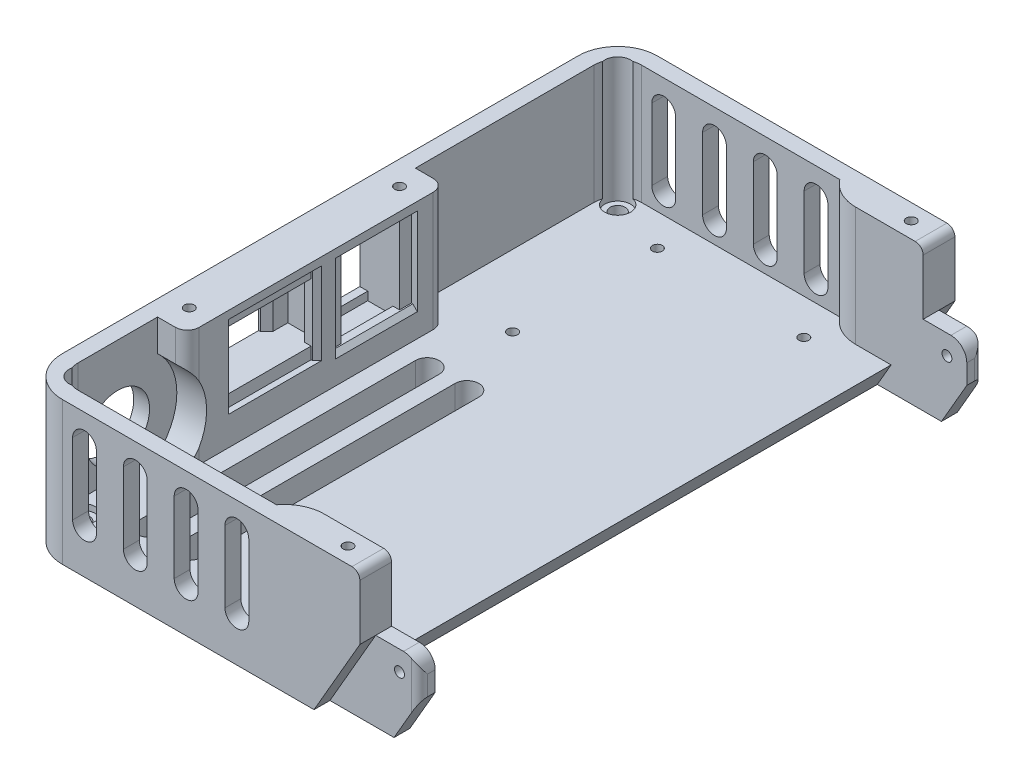
from build123d import *

# Parameters (mm, degrees)
BOSS_EXTRUDE1_DEPTH      = 150
FILLET1_R                = 10
CUT_EXTRUDE1_DEPTH       = 14
SKETCH3_W                = 36
SKETCH3_H                = 4
BOSS_EXTRUDE2_DEPTH      = 20
FILLET2_R                = 10
CUT_EXTRUDE2_DEPTH       = 176.874955579
FILLET3_R                = 4
SKETCH5_R                = 1.25
CUT_EXTRUDE3_DEPTH       = 176.874955579
FILLET4_R                = 2
SKETCH6_W                = 11.5
SKETCH6_H                = 65
BOSS_EXTRUDE3_DEPTH      = 30
CUT_EXTRUDE7_DEPTH       = 14.7
CUT_EXTRUDE8_DEPTH       = 17.7
CUT_EXTRUDE8_DEPTH_BACK  = 3
CUT_EXTRUDE9_DEPTH       = 14.7
CUT_EXTRUDE10_DEPTH      = 17.7
CUT_EXTRUDE10_DEPTH_BACK = 3
SKETCH25_W               = 6.35
SKETCH25_H               = 14.7
CUT_EXTRUDE19_DEPTH      = 1.5
CUT_EXTRUDE20_DEPTH      = 1.5
CHAMFER1_SIZE            = 1
SKETCH16_R               = 1.25
CUT_EXTRUDE11_DEPTH      = 181.599003373
BOSS_EXTRUDE4_DEPTH      = 16
FILLET5_R                = 3
CUT_EXTRUDE12_DEPTH      = 181.599003373
SKETCH19_R               = 1.9
CUT_EXTRUDE13_DEPTH      = 182.69204721
SKETCH20_R               = 3.25
CUT_EXTRUDE14_DEPTH      = 31.5
CUT_EXTRUDE15_DEPTH      = 179.404035883
CUT_EXTRUDE15_DEPTH_BACK = 179.404035883
SKETCH22_R               = 1.25
CUT_EXTRUDE16_DEPTH      = 8
FILLET6_R                = 2
SKETCH23_R               = 8
CUT_EXTRUDE17_DEPTH      = 180.610690156
CUT_EXTRUDE18_REACH      = 177.887


with BuildPart() as part:
    # Sketch1 → Boss-Extrude1 (new body)
    with BuildSketch(Plane.XY):
        Polygon((0, 0), (73.452994616, 0), (85, 20), (0, 20), align=None)
    extrude(amount=BOSS_EXTRUDE1_DEPTH)

    # Fillet1
    fillet1_edges = [part.edges().sort_by_distance(p)[0] for p in [
        (0, 10, 150),
        (0, 10, 0),
    ]]
    fillet(fillet1_edges, radius=FILLET1_R)

    # Sketch2 → Cut-Extrude1 (cut)
    with BuildSketch(Plane(origin=(0, 20, 0), x_dir=(1, 0, 0), z_dir=(0, 1, 0))):
        with BuildLine():
            Line((85, -4), (10, -4))
            ThreePointArc((10, -4), (5.757359313, -5.757359313), (4, -10))
            Line((4, -10), (4, -140))
            ThreePointArc((4, -140), (5.757359313, -144.242640687), (10, -146))
            Line((10, -146), (85, -146))
            Line((85, -146), (85, -4))
        make_face()
    extrude(amount=-CUT_EXTRUDE1_DEPTH, mode=Mode.SUBTRACT)

    # Sketch3 → Boss-Extrude2 (add)
    with BuildSketch(Plane.XZ):
        with Locations((78, 144)):
            Rectangle(SKETCH3_W, SKETCH3_H)
        with Locations((78, 6)):
            Rectangle(SKETCH3_W, SKETCH3_H)
    extrude(amount=-BOSS_EXTRUDE2_DEPTH)

    # Fillet2
    # the kernel refuses this fillet: 10 mm, written as the material it takes off along each edge
    with BuildSketch(Plane(origin=(60, 6, 142), x_dir=(0, 0, 1), z_dir=(0, 1, 0))) as fillet2_piece_1:
        with BuildLine():
            CenterArc((10, 8), FILLET2_R, 180, 53.130102354)
            Line((0, 8), (0, 0))
            Line((0, 0), (4, 0))
        make_face()
    extrude(amount=34, mode=Mode.SUBTRACT)
    with BuildSketch(Plane(origin=(60, 6, 8), x_dir=(0, 0, -1), z_dir=(0, 1, 0))) as fillet2_piece_2:
        with BuildLine():
            CenterArc((10, -8), FILLET2_R, 126.869897646, 53.130102354)
            Line((0, -8), (0, 0))
            Line((0, 0), (4, 0))
        make_face()
    extrude(amount=34, mode=Mode.SUBTRACT)

    # Sketch4 → Cut-Extrude2 (cut, through all)
    with BuildSketch(Plane(origin=(0, 0, 4), x_dir=(-1, 0, 0), z_dir=(0, 0, -1))):
        Polygon((-89.618802154, 0), (-96, 11.052558883), (-96, 0), align=None)
    extrude(amount=-CUT_EXTRUDE2_DEPTH, mode=Mode.SUBTRACT)

    # Fillet3
    fillet3_edges = [part.edges().sort_by_distance(p)[0] for p in [
        (96, 20, 144),
        (96, 20, 6),
    ]]
    fillet(fillet3_edges, radius=FILLET3_R)

    # Sketch5 → Cut-Extrude3 (cut, through all)
    with BuildSketch(Plane(origin=(0, 0, 4), x_dir=(-1, 0, 0), z_dir=(0, 0, -1))):
        with Locations((-91, 15)):
            Circle(SKETCH5_R)
    extrude(amount=-CUT_EXTRUDE3_DEPTH, mode=Mode.SUBTRACT)

    # Fillet4
    # the kernel refuses this fillet: 2 mm, written as the material it takes off along each edge
    with BuildSketch(Plane(origin=(96, 6.052558883, 146), x_dir=(-1, 0, 0), z_dir=(0, 1, 0))) as fillet4_piece_1:
        with BuildLine():
            CenterArc((FILLET4_R, -FILLET4_R), FILLET4_R, 90, 90)
            Line((0, -FILLET4_R), (0, 0))
            Line((0, 0), (FILLET4_R, 0))
        make_face()
    extrude(amount=14.947441117, mode=Mode.SUBTRACT)
    with BuildSketch(Plane(origin=(96, 6.052558883, 4), x_dir=(-1, 0, 0), z_dir=(0, 1, 0))) as fillet4_piece_2:
        with BuildLine():
            CenterArc((FILLET4_R, FILLET4_R), FILLET4_R, 180, 90)
            Line((0, FILLET4_R), (0, 0))
            Line((0, 0), (FILLET4_R, 0))
        make_face()
    extrude(amount=14.947441117, mode=Mode.SUBTRACT)

    # Sketch6 → Boss-Extrude3 (add)
    with BuildSketch(Plane(origin=(0, 6, 0), x_dir=(1, 0, 0), z_dir=(0, 1, 0))):
        with Locations((5.75, -87.5)):
            Rectangle(SKETCH6_W, SKETCH6_H)
    extrude(amount=BOSS_EXTRUDE3_DEPTH)

    # Sketch12 → Cut-Extrude7 (cut)
    with BuildSketch(Plane(origin=(0, 0, 65), x_dir=(0, -1, 0), z_dir=(0, 0, 1))):
        Polygon((-33.95, 11.55), (-11.85, 11.55), (-13.05, 10.35), (-13.05, 8.35), (-11.05, 8.35), (-11.05, 2), (-13.15, 2), (-13.15, 0), (-29.65, 0), (-29.65, 0.4), (-31.25, 2), (-35, 2), (-35, 8.35), (-32.75, 8.35), (-32.75, 10.35), align=None)
    extrude(amount=CUT_EXTRUDE7_DEPTH, mode=Mode.SUBTRACT)

    # Sketch13 → Cut-Extrude8 (cut, two sides: drawn at the far end of the back side and taken through both)
    with BuildSketch(Plane.XY.offset(65).offset(-CUT_EXTRUDE8_DEPTH_BACK)):
        Polygon((10.35, 13.05), (11.5, 11.9), (11.5, 33.9), (10.35, 32.75), (10, 32.75), (10, 13.05), align=None)
    extrude(amount=CUT_EXTRUDE8_DEPTH + CUT_EXTRUDE8_DEPTH_BACK, mode=Mode.SUBTRACT)

    # Sketch14 → Cut-Extrude9 (cut)
    with BuildSketch(Plane(origin=(175.477091495, 31, 46.465200249), x_dir=(0, 0, 1), z_dir=(0, 1, 0))):
        Polygon((39.634799751, -163.927091495), (61.834799751, -163.927091495), (60.634799751, -165.127091495), (60.634799751, -167.127091495), (62.534799751, -167.127091495), (62.534799751, -173.477091495), (60.534799751, -173.477091495), (60.534799751, -175.477091495), (44.034799751, -175.477091495), (44.034799751, -175.077091495), (42.434799751, -173.477091495), (38.684799751, -173.477091495), (38.684799751, -167.127091495), (40.834799751, -167.127091495), (40.834799751, -165.127091495), align=None)
    extrude(amount=-CUT_EXTRUDE9_DEPTH, mode=Mode.SUBTRACT)

    # Sketch15 → Cut-Extrude10 (cut, two sides: drawn at the far end of the back side and taken through both)
    with BuildSketch(Plane(origin=(0, 16.3, 0), x_dir=(1, 0, 0), z_dir=(0, 1, 0)).offset(-CUT_EXTRUDE10_DEPTH_BACK)):
        Polygon((10, -87.3), (10, -107.1), (10.35, -107.1), (11.5, -108.25), (11.5, -86.15), (10.35, -87.3), align=None)
    extrude(amount=CUT_EXTRUDE10_DEPTH + CUT_EXTRUDE10_DEPTH_BACK, mode=Mode.SUBTRACT)

    # Sketch25 → Cut-Extrude19 (cut)
    with BuildSketch(Plane(origin=(0, 0, 109), x_dir=(-1, 0, 0), z_dir=(0, 0, -1))):
        with Locations((-5.175, 23.65)):
            Rectangle(SKETCH25_W, SKETCH25_H)
    extrude(amount=-CUT_EXTRUDE19_DEPTH, mode=Mode.SUBTRACT)

    # Sketch27 → Cut-Extrude20 (cut)
    with BuildSketch(Plane(origin=(0, 0, 107.1), x_dir=(-1, 0, 0), z_dir=(0, 0, -1))):
        Polygon((-10.35, 34), (-12.526064563, 34), (-12.526064563, 13.3), (-10.35, 13.3), (-10, 13.3), (-10, 16.3), (-8.35, 16.3), (-8.35, 31), (-10, 31), (-10, 34), align=None)
    extrude(amount=-CUT_EXTRUDE20_DEPTH, mode=Mode.SUBTRACT)

    # Chamfer1
    chamfer1_edges = [part.edges().sort_by_distance(p)[0] for p in [
        (11.5, 23.65, 108.6),
    ]]
    chamfer(chamfer1_edges, length=CHAMFER1_SIZE)

    # Sketch16 → Cut-Extrude11 (cut, through all)
    with BuildSketch(Plane(origin=(0, 6, 0), x_dir=(1, 0, 0), z_dir=(0, 1, 0))):
        with Locations(Location((22, -12, 0), (0, 0, 270))):
            Circle(SKETCH16_R)
        with Locations(Location((22, -48.5, 0), (0, 0, 270))):
            Circle(SKETCH16_R)
        with Locations(Location((59.917096231, -13, 0), (0, 0, 270))):
            Circle(SKETCH16_R)
        with Locations(Location((59.917096231, -137, 0), (0, 0, 270))):
            Circle(SKETCH16_R)
    extrude(amount=-CUT_EXTRUDE11_DEPTH, mode=Mode.SUBTRACT)

    # Sketch17 → Boss-Extrude4 (add)
    with BuildSketch(Plane(origin=(0, 20, 0), x_dir=(1, 0, 0), z_dir=(0, 1, 0))):
        with BuildLine():
            Line((0, -55), (4, -55))
            Line((4, -55), (4, -10))
            ThreePointArc((4, -10), (5.757359313, -5.757359313), (10, -4))
            Line((10, -4), (60, -4))
            ThreePointArc((60, -4), (63.527864045, -6.94427191), (68, -8))
            Line((68, -8), (85, -8))
            Line((85, -8), (85, 0))
            Line((85, 0), (10, 0))
            ThreePointArc((10, 0), (2.928932188, -2.928932188), (0, -10))
            Line((0, -10), (0, -55))
        make_face()
        with BuildLine():
            Line((4, -120), (0, -120))
            Line((0, -120), (0, -140))
            ThreePointArc((0, -140), (2.928932188, -147.071067812), (10, -150))
            Line((10, -150), (85, -150))
            Line((85, -150), (85, -142))
            Line((85, -142), (68, -142))
            ThreePointArc((68, -142), (63.527864045, -143.05572809), (60, -146))
            Line((60, -146), (10, -146))
            ThreePointArc((10, -146), (5.757359313, -144.242640687), (4, -140))
            Line((4, -140), (4, -120))
        make_face()
    extrude(amount=BOSS_EXTRUDE4_DEPTH)

    # Fillet5
    fillet5_edges = [part.edges().sort_by_distance(p)[0] for p in [
        (11.5, 21, 55),
        (11.5, 21, 120),
    ]]
    fillet(fillet5_edges, radius=FILLET5_R)

    # Sketch18 → Cut-Extrude12 (cut, through all)
    with BuildSketch(Plane(origin=(0, 6, 0), x_dir=(1, 0, 0), z_dir=(0, 1, 0))):
        with BuildLine():
            Line((22, -67), (22, -137))
            ThreePointArc((22, -137), (19, -140), (16, -137))
            Line((16, -137), (16, -67))
            ThreePointArc((16, -67), (19, -64), (22, -67))
        make_face()
        with BuildLine():
            Line((32, -67), (32, -137))
            ThreePointArc((32, -137), (29, -140), (26, -137))
            Line((26, -137), (26, -67))
            ThreePointArc((26, -67), (29, -64), (32, -67))
        make_face()
    extrude(amount=-CUT_EXTRUDE12_DEPTH, mode=Mode.SUBTRACT)

    # Sketch19 → Cut-Extrude13 (cut, through all)
    with BuildSketch(Plane.XZ):
        with Locations(Location((7.5, 142.5, 0), (0, 0, 270))):
            Circle(SKETCH19_R)
        with Locations(Location((7.5, 7.5, 0), (0, 0, 270))):
            Circle(SKETCH19_R)
    extrude(amount=-CUT_EXTRUDE13_DEPTH, mode=Mode.SUBTRACT)

    # Sketch20 → Cut-Extrude14 (cut)
    with BuildSketch(Plane(origin=(0, 36, 0), x_dir=(1, 0, 0), z_dir=(0, 1, 0))):
        with Locations(Location((7.5, -7.5, 0), (0, 0, 270))):
            Circle(SKETCH20_R)
        with Locations(Location((7.5, -142.5, 0), (0, 0, 270))):
            Circle(SKETCH20_R)
    extrude(amount=-CUT_EXTRUDE14_DEPTH, mode=Mode.SUBTRACT)

    # Sketch21 → Cut-Extrude15 (cut, two sides: drawn at the far end of the back side and taken through both)
    with BuildSketch(Plane(origin=(0, 0, 146), x_dir=(-1, 0, 0), z_dir=(0, 0, -1)).offset(-CUT_EXTRUDE15_DEPTH_BACK)):
        with BuildLine():
            Line((-51, 29), (-51, 11))
            ThreePointArc((-51, 11), (-54, 8), (-57, 11))
            Line((-57, 11), (-57, 29))
            ThreePointArc((-57, 29), (-54, 32), (-51, 29))
        make_face()
        with BuildLine():
            Line((-38.2, 29), (-38.2, 11))
            ThreePointArc((-38.2, 11), (-41.2, 8), (-44.2, 11))
            Line((-44.2, 11), (-44.2, 29))
            ThreePointArc((-44.2, 29), (-41.2, 32), (-38.2, 29))
        make_face()
        with BuildLine():
            Line((-25.4, 29), (-25.4, 11))
            ThreePointArc((-25.4, 11), (-28.4, 8), (-31.4, 11))
            Line((-31.4, 11), (-31.4, 29))
            ThreePointArc((-31.4, 29), (-28.4, 32), (-25.4, 29))
        make_face()
        with BuildLine():
            Line((-12.6, 29), (-12.6, 11))
            ThreePointArc((-12.6, 11), (-15.6, 8), (-18.6, 11))
            Line((-18.6, 11), (-18.6, 29))
            ThreePointArc((-18.6, 29), (-15.6, 32), (-12.6, 29))
        make_face()
    extrude(amount=CUT_EXTRUDE15_DEPTH + CUT_EXTRUDE15_DEPTH_BACK, mode=Mode.SUBTRACT)

    # Sketch22 → Cut-Extrude16 (cut)
    with BuildSketch(Plane(origin=(0, 36, 0), x_dir=(1, 0, 0), z_dir=(0, 1, 0))):
        with Locations(Location((78, -4, 0), (0, 0, 270))):
            Circle(SKETCH22_R)
        with Locations(Location((78, -146, 0), (0, 0, 270))):
            Circle(SKETCH22_R)
        with Locations(Location((6, -114, 0), (0, 0, 270))):
            Circle(SKETCH22_R)
        with Locations(Location((6, -61, 0), (0, 0, 270))):
            Circle(SKETCH22_R)
    extrude(amount=-CUT_EXTRUDE16_DEPTH, mode=Mode.SUBTRACT)

    # Fillet6
    fillet6_edges = [part.edges().sort_by_distance(p)[0] for p in [
        (85, 36, 4),
        (85, 36, 146),
    ]]
    fillet(fillet6_edges, radius=FILLET6_R)

    # Sketch23 → Cut-Extrude17 (cut, through all)
    with BuildSketch(Plane(origin=(4, 0, 0), x_dir=(0, 0, -1), z_dir=(1, 0, 0))):
        with Locations(Location((-130, 17, 0), (0, 0, 90))):
            Circle(SKETCH23_R)
    extrude(amount=-CUT_EXTRUDE17_DEPTH, mode=Mode.SUBTRACT)

    # Cut-Extrude18: up to this face of the body (flat: up to its plane)
    cut_extrude18_end = Plane(part.part.faces().sort_by_distance((4, 21, 139.639444872))[0])
    # Sketch24 → Cut-Extrude18 (cut, up to the picked face)
    with BuildSketch(Plane(origin=(11.5, 0, 0), x_dir=(0, 0, -1), z_dir=(1, 0, 0)), mode=Mode.PRIVATE) as cut_extrude18_sk1:
        with BuildLine():
            Line((-120, 6), (-120, 28))
            ThreePointArc((-120, 28), (-115.133931253, 17), (-120, 6))
        make_face()
    cut_extrude18_tool1 = split(extrude(cut_extrude18_sk1.sketch, amount=-CUT_EXTRUDE18_REACH, mode=Mode.PRIVATE), bisect_by=cut_extrude18_end, keep=Keep.BOTH, mode=Mode.PRIVATE)
    # Sketch24 → Cut-Extrude18 (cut, up to the picked face)
    with BuildSketch(Plane(origin=(11.5, 0, 0), x_dir=(0, 0, -1), z_dir=(1, 0, 0)), mode=Mode.PRIVATE) as cut_extrude18_sk2:
        with BuildLine():
            Line((-140, 6), (-140, 28))
            ThreePointArc((-140, 28), (-144.866068747, 17), (-140, 6))
        make_face()
    cut_extrude18_tool2 = split(extrude(cut_extrude18_sk2.sketch, amount=-CUT_EXTRUDE18_REACH, mode=Mode.PRIVATE), bisect_by=cut_extrude18_end, keep=Keep.BOTH, mode=Mode.PRIVATE)
    add(cut_extrude18_tool1.solids().sort_by(Axis((11.5, 17, 118.023391), (-1, 0, 0)))[0], mode=Mode.SUBTRACT)
    add(cut_extrude18_tool2.solids().sort_by(Axis((11.5, 17, 141.976609), (-1, 0, 0)))[0], mode=Mode.SUBTRACT)


solid = part.part
